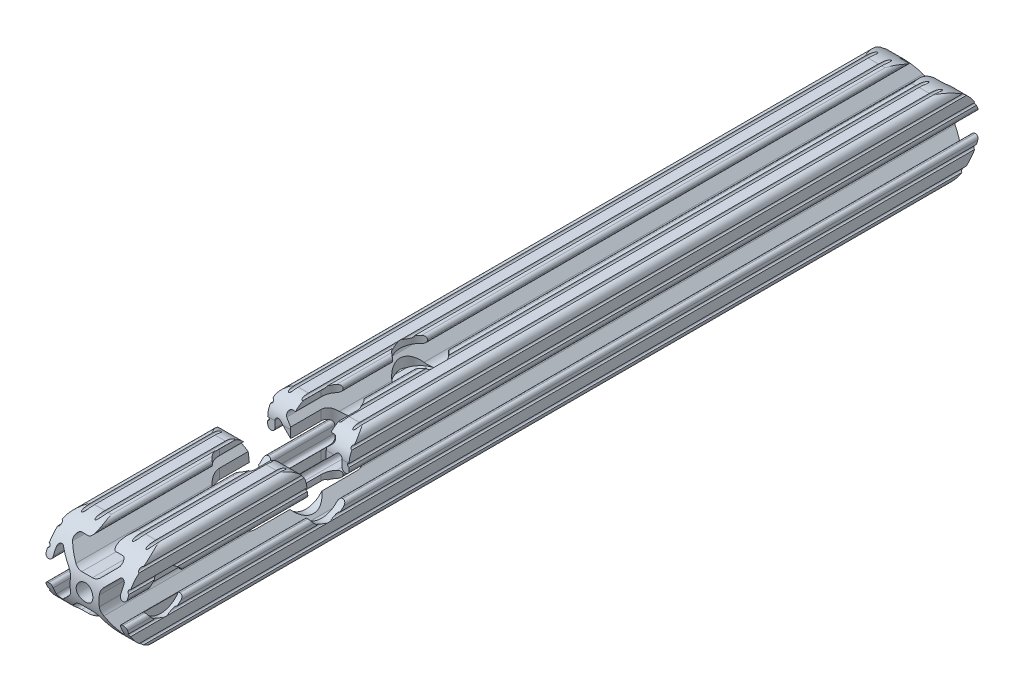
from build123d import *
from OCP.BRepAlgoAPI import BRepAlgoAPI_Cut
from OCP.TopTools import TopTools_ListOfShape

# Parameters (mm, degrees)
SKETCH1_R               = 2.6035
BOSS_EXTRUDE1_DEPTH     = 133.35
CUT_EXTRUDE1_DEPTH      = 136.054229746
CUT_EXTRUDE1_DEPTH_BACK = 136.054229746
SKETCH2_R               = 3.175
SKETCH3_R               = 6.35
CUT_EXTRUDE2_DEPTH      = 1.5875
CUT_EXTRUDE3_START      = -23.8125
SKETCH3_2_R             = 6.35
CUT_EXTRUDE3_DEPTH      = 1.5875
CUT_EXTRUDE10_START     = -26
CUT_EXTRUDE10_DEPTH     = 27
SKETCH8_R               = 3.175
CUT_EXTRUDE8_DEPTH      = 137.340282141
CUT_EXTRUDE11_DEPTH     = 137.340282141
CUT_EXTRUDE12_REACH     = 138.34
SKETCH11_R              = 6.35


with BuildPart() as part:
    # Sketch1 → Boss-Extrude1 (new, symmetric)
    with BuildSketch(Plane.XY):
        with BuildLine():
            Line((-7.179650497, -8.645192506), (-3.952270251, -5.423690499))
            ThreePointArc((-3.952270251, -5.423690499), (-2.922936451, -4.736929036), (-1.709253557, -4.4958))
            Line((-1.709253557, -4.4958), (1.709253557, -4.4958))
            ThreePointArc((1.709253557, -4.4958), (2.922936451, -4.736929036), (3.952270251, -5.423690499))
            Line((3.952270251, -5.423690499), (7.179650497, -8.645192506))
            ThreePointArc((7.179650497, -8.645192506), (7.41473083, -9.822813117), (6.416408329, -10.4902))
            Line((6.416408329, -10.4902), (4.287512407, -10.4902))
            ThreePointArc((4.287512407, -10.4902), (3.54574862, -10.79744862), (3.2385, -11.539212407))
            Line((3.2385, -11.539212407), (3.2385, -11.650987593))
            ThreePointArc((3.2385, -11.650987593), (3.54574862, -12.39275138), (4.287512407, -12.7))
            Line((4.287512407, -12.7), (5.317126718, -12.7))
            ThreePointArc((5.317126718, -12.7), (5.825126718, -12.192), (6.333126718, -12.7))
            Line((6.333126718, -12.7), (9.550443118, -12.7))
            ThreePointArc((9.550443118, -12.7), (10.058366869, -12.192000006), (10.566443095, -12.699847501))
            ThreePointArc((10.566443095, -12.699847501), (12.082537762, -12.08250727), (12.699846982, -10.566399977))
            ThreePointArc((12.699846982, -10.566399977), (12.192000006, -10.058323491), (12.7, -9.5504))
            Line((12.7, -9.5504), (12.7, -6.3330836))
            ThreePointArc((12.7, -6.3330836), (12.192, -5.8250836), (12.7, -5.3170836))
            Line((12.7, -5.3170836), (12.7, -4.287469289))
            ThreePointArc((12.7, -4.287469289), (12.39275138, -3.545705502), (11.650987593, -3.238456882))
            Line((11.650987593, -3.238456882), (11.539212407, -3.238456882))
            ThreePointArc((11.539212407, -3.238456882), (10.79744862, -3.545705502), (10.4902, -4.287469289))
            Line((10.4902, -4.287469289), (10.4902, -6.402089023))
            ThreePointArc((10.4902, -6.402089023), (9.856505071, -7.351067942), (8.737131347, -7.129408934))
            Line((8.737131347, -7.129408934), (5.441005833, -3.840816462))
            ThreePointArc((5.441005833, -3.840816462), (4.750877967, -2.809883091), (4.5085, -1.593185507))
            Line((4.5085, -1.593185507), (4.5085, 1.593185507))
            ThreePointArc((4.5085, 1.593185507), (4.750877967, 2.809883091), (5.441005833, 3.840816462))
            Line((5.441005833, 3.840816462), (8.737131347, 7.129408934))
            ThreePointArc((8.737131347, 7.129408934), (9.856505071, 7.351067942), (10.4902, 6.402089023))
            Line((10.4902, 6.402089023), (10.4902, 4.287469289))
            ThreePointArc((10.4902, 4.287469289), (10.79744862, 3.545705502), (11.539212407, 3.238456882))
            Line((11.539212407, 3.238456882), (11.650987593, 3.238456882))
            ThreePointArc((11.650987593, 3.238456882), (12.39275138, 3.545705502), (12.7, 4.287469289))
            Line((12.7, 4.287469289), (12.7, 5.3170836))
            ThreePointArc((12.7, 5.3170836), (12.192, 5.8250836), (12.7, 6.3330836))
            Line((12.7, 6.3330836), (12.7, 9.5504))
            ThreePointArc((12.7, 9.5504), (12.192000006, 10.058323491), (12.699846982, 10.566399977))
            ThreePointArc((12.699846982, 10.566399977), (12.082537762, 12.08250727), (10.566443095, 12.699847501))
            ThreePointArc((10.566443095, 12.699847501), (10.058366869, 12.192000006), (9.550443118, 12.7))
            Line((9.550443118, 12.7), (6.333126718, 12.7))
            ThreePointArc((6.333126718, 12.7), (5.825126718, 12.192), (5.317126718, 12.7))
            Line((5.317126718, 12.7), (4.287512407, 12.7))
            ThreePointArc((4.287512407, 12.7), (3.54574862, 12.39275138), (3.2385, 11.650987593))
            Line((3.2385, 11.650987593), (3.2385, 11.539212407))
            ThreePointArc((3.2385, 11.539212407), (3.54574862, 10.79744862), (4.287512407, 10.4902))
            Line((4.287512407, 10.4902), (6.476788598, 10.4902))
            ThreePointArc((6.476788598, 10.4902), (7.432222385, 9.85140422), (7.207036008, 8.724370562))
            Line((7.207036008, 8.724370562), (3.898272566, 5.423169045))
            ThreePointArc((3.898272566, 5.423169045), (2.869120213, 4.736787962), (1.655778399, 4.4958))
            Line((1.655778399, 4.4958), (-1.655778399, 4.4958))
            ThreePointArc((-1.655778399, 4.4958), (-2.869120213, 4.736787962), (-3.898272566, 5.423169045))
            Line((-3.898272566, 5.423169045), (-7.207036008, 8.724370562))
            ThreePointArc((-7.207036008, 8.724370562), (-7.432222385, 9.85140422), (-6.476788598, 10.4902))
            Line((-6.476788598, 10.4902), (-4.287512407, 10.4902))
            ThreePointArc((-4.287512407, 10.4902), (-3.54574862, 10.79744862), (-3.2385, 11.539212407))
            Line((-3.2385, 11.539212407), (-3.2385, 11.650987593))
            ThreePointArc((-3.2385, 11.650987593), (-3.54574862, 12.39275138), (-4.287512407, 12.7))
            Line((-4.287512407, 12.7), (-5.317126718, 12.7))
            ThreePointArc((-5.317126718, 12.7), (-5.825126718, 12.192), (-6.333126718, 12.7))
            Line((-6.333126718, 12.7), (-9.550443118, 12.7))
            ThreePointArc((-9.550443118, 12.7), (-10.058366869, 12.192000006), (-10.566443095, 12.699847501))
            ThreePointArc((-10.566443095, 12.699847501), (-12.082537762, 12.08250727), (-12.699846982, 10.566399977))
            ThreePointArc((-12.699846982, 10.566399977), (-12.192000006, 10.058323491), (-12.7, 9.5504))
            Line((-12.7, 9.5504), (-12.7, 6.3330836))
            ThreePointArc((-12.7, 6.3330836), (-12.192, 5.8250836), (-12.7, 5.3170836))
            Line((-12.7, 5.3170836), (-12.7, 4.287469289))
            ThreePointArc((-12.7, 4.287469289), (-12.39275138, 3.545705502), (-11.650987593, 3.238456882))
            Line((-11.650987593, 3.238456882), (-11.539212407, 3.238456882))
            ThreePointArc((-11.539212407, 3.238456882), (-10.79744862, 3.545705502), (-10.4902, 4.287469289))
            Line((-10.4902, 4.287469289), (-10.4902, 6.402089023))
            ThreePointArc((-10.4902, 6.402089023), (-9.856505071, 7.351067942), (-8.737131347, 7.129408934))
            Line((-8.737131347, 7.129408934), (-5.441005833, 3.840816462))
            ThreePointArc((-5.441005833, 3.840816462), (-4.750877967, 2.809883091), (-4.5085, 1.593185507))
            Line((-4.5085, 1.593185507), (-4.5085, -1.593185507))
            ThreePointArc((-4.5085, -1.593185507), (-4.750877967, -2.809883091), (-5.441005833, -3.840816462))
            Line((-5.441005833, -3.840816462), (-8.737131347, -7.129408934))
            ThreePointArc((-8.737131347, -7.129408934), (-9.856505071, -7.351067942), (-10.4902, -6.402089023))
            Line((-10.4902, -6.402089023), (-10.4902, -4.287469289))
            ThreePointArc((-10.4902, -4.287469289), (-10.79744862, -3.545705502), (-11.539212407, -3.238456882))
            Line((-11.539212407, -3.238456882), (-11.650987593, -3.238456882))
            ThreePointArc((-11.650987593, -3.238456882), (-12.39275138, -3.545705502), (-12.7, -4.287469289))
            Line((-12.7, -4.287469289), (-12.7, -5.3170836))
            ThreePointArc((-12.7, -5.3170836), (-12.192, -5.8250836), (-12.7, -6.3330836))
            Line((-12.7, -6.3330836), (-12.7, -9.5504))
            ThreePointArc((-12.7, -9.5504), (-12.192000006, -10.058323491), (-12.699846982, -10.566399977))
            ThreePointArc((-12.699846982, -10.566399977), (-12.082537762, -12.08250727), (-10.566443095, -12.699847501))
            ThreePointArc((-10.566443095, -12.699847501), (-10.058366869, -12.192000006), (-9.550443118, -12.7))
            Line((-9.550443118, -12.7), (-6.333126718, -12.7))
            ThreePointArc((-6.333126718, -12.7), (-5.825126718, -12.192), (-5.317126718, -12.7))
            Line((-5.317126718, -12.7), (-4.287512407, -12.7))
            ThreePointArc((-4.287512407, -12.7), (-3.54574862, -12.39275138), (-3.2385, -11.650987593))
            Line((-3.2385, -11.650987593), (-3.2385, -11.539212407))
            ThreePointArc((-3.2385, -11.539212407), (-3.54574862, -10.79744862), (-4.287512407, -10.4902))
            Line((-4.287512407, -10.4902), (-6.416408329, -10.4902))
            ThreePointArc((-6.416408329, -10.4902), (-7.41473083, -9.822813117), (-7.179650497, -8.645192506))
        make_face()
        Circle(SKETCH1_R, mode=Mode.SUBTRACT)
    extrude(amount=BOSS_EXTRUDE1_DEPTH, both=True)

    # Sketch2 → Cut-Extrude1 (cut, two sides: drawn at the far end of the back side and taken through both)
    with BuildSketch(Plane(origin=(4.5085, 0, 0), x_dir=(0, 0, -1), z_dir=(1, 0, 0)).offset(-CUT_EXTRUDE1_DEPTH_BACK)):
        with Locations(Location((-120.65, 0, 0), (0, 0, 149.88145664))):
            Circle(SKETCH2_R)
    extrude(amount=CUT_EXTRUDE1_DEPTH + CUT_EXTRUDE1_DEPTH_BACK, mode=Mode.SUBTRACT)

    # Sketch3 → Cut-Extrude2 (cut)
    with BuildSketch(Plane(origin=(12.7, 0, 0), x_dir=(0, 0, -1), z_dir=(1, 0, 0))):
        with Locations((-120.65, 0)):
            Circle(SKETCH3_R)
    extrude(amount=-CUT_EXTRUDE2_DEPTH, mode=Mode.SUBTRACT)

    # Sketch3<2> → Cut-Extrude3 (cut)
    with BuildSketch(Plane(origin=(12.7, 0, 0), x_dir=(0, 0, -1), z_dir=(1, 0, 0)).offset(CUT_EXTRUDE3_START)):
        with Locations((-120.65, 0)):
            Circle(SKETCH3_2_R)
    extrude(amount=-CUT_EXTRUDE3_DEPTH, mode=Mode.SUBTRACT)


with BuildPart() as cut_extrude10_tool:
    # Cut-Extrude10: read off the stored shape, not the designer's step
    # Cut-Extrude10 outline → Cut-Extrude10 (new body)
    with BuildSketch(Plane(origin=(12.7, 0, 0), x_dir=(0, 0, -1), z_dir=(1, 0, 0)).offset(CUT_EXTRUDE10_START)):
        with BuildLine():
            ThreePointArc((-76.2, 7.6249e-05), (-69.85, -6.349923751), (-63.5, 7.6249e-05))
            Line((-63.5, 7.6249e-05), (-63.5, 6.35))
            ThreePointArc((-63.5, 6.35), (-61.640128061, 10.840128061), (-57.15, 12.7))
            Line((-57.15, 12.7), (-83.082893377, 12.7))
            ThreePointArc((-83.082893377, 12.7), (-78.983986003, 11.19989261), (-76.82170894, 7.408333333))
            ThreePointArc((-76.82170894, 7.408333333), (-76.355703117, 3.71722526), (-76.2, 7.6249e-05))
        make_face()
    extrude(amount=CUT_EXTRUDE10_DEPTH)


with BuildPart() as part_1:
    add(part.part)

    # Cut-Extrude10: cut by cut_extrude10_tool, with a tolerance
    cut_extrude10_stock = TopTools_ListOfShape()
    cut_extrude10_stock.Append(part_1.part.wrapped)
    cut_extrude10_tools = TopTools_ListOfShape()
    cut_extrude10_tools.Append(cut_extrude10_tool.part.wrapped)
    cut_extrude10_cut = BRepAlgoAPI_Cut()
    cut_extrude10_cut.SetArguments(cut_extrude10_stock)
    cut_extrude10_cut.SetTools(cut_extrude10_tools)
    cut_extrude10_cut.SetFuzzyValue(0.00001)
    cut_extrude10_cut.Build()
    add(Compound.cast(cut_extrude10_cut.Shape()).solids(), mode=Mode.REPLACE)

    # Sketch8 → Cut-Extrude8 (cut, through all)
    with BuildSketch(Plane.XZ.offset(12.7)):
        with BuildLine():
            Line((5.556173491, 85.725), (5.556173491, 53.975))
            ThreePointArc((5.556173491, 53.975), (-7.6509e-05, 48.41875), (-5.556326509, 53.975))
            Line((-5.556326509, 53.975), (-5.556326509, 85.725))
            ThreePointArc((-5.556326509, 85.725), (-7.6509e-05, 91.28125), (5.556173491, 85.725))
        make_face()
        with Locations(Location((-7.6509e-05, 28.575, 0), (0, 0, 238.568359455))):
            Circle(SKETCH8_R)
    extrude(amount=-CUT_EXTRUDE8_DEPTH, mode=Mode.SUBTRACT)

    # Sketch10 → Cut-Extrude11 (cut, through all)
    with BuildSketch(Plane(origin=(12.7, 0, 0), x_dir=(0, 0, -1), z_dir=(1, 0, 0))):
        with BuildLine():
            ThreePointArc((-120.65, -12.7), (-129.630256121, -8.980256121), (-133.35, 0))
            Line((-133.35, 0), (-133.35, -12.7))
            Line((-133.35, -12.7), (-120.65, -12.7))
        make_face()
        with BuildLine():
            Line((133.35, 12.7), (120.65, 12.7))
            ThreePointArc((120.65, 12.7), (129.630256121, 8.980256121), (133.35, 0))
            Line((133.35, 0), (133.35, 12.7))
        make_face()
        with BuildLine():
            Line((133.35, -12.7), (133.35, 0))
            ThreePointArc((133.35, 0), (129.630256121, -8.980256121), (120.65, -12.7))
            Line((120.65, -12.7), (133.35, -12.7))
        make_face()
        with BuildLine():
            Line((-131.658271986, 6.3330836), (-133.35, 6.3330836))
            Line((-133.35, 6.3330836), (-133.35, 0))
            ThreePointArc((-133.35, 0), (-132.919781054, 3.277571188), (-131.658271986, 6.3330836))
        make_face()
        with BuildLine():
            Line((-129.021371443, 9.5504), (-133.35, 9.5504))
            Line((-133.35, 9.5504), (-133.35, 6.3330836))
            Line((-133.35, 6.3330836), (-131.658271986, 6.3330836))
            ThreePointArc((-131.658271986, 6.3330836), (-130.472445015, 8.050439363), (-129.021371443, 9.5504))
        make_face()
        with BuildLine():
            Line((-120.65, 12.7), (-133.35, 12.7))
            Line((-133.35, 12.7), (-133.35, 9.5504))
            Line((-133.35, 9.5504), (-129.021371443, 9.5504))
            ThreePointArc((-129.021371443, 9.5504), (-125.122131483, 11.8865487), (-120.65, 12.7))
        make_face()
    extrude(amount=-CUT_EXTRUDE11_DEPTH, mode=Mode.SUBTRACT)

    # Cut-Extrude12: up to this face of the body (flat: up to its plane)
    cut_extrude12_end = Plane(part_1.part.faces().sort_by_distance((1.53e-07, 4.4958, -53.488525303))[0])
    # Sketch11 → Cut-Extrude12 (cut, up to the picked face)
    with BuildSketch(Plane(origin=(0, 12.7, 0), x_dir=(1, 0, 0), z_dir=(0, 1, 0)), mode=Mode.PRIVATE) as cut_extrude12_sk1:
        with Locations((-7.6509e-05, -28.575)):
            Circle(SKETCH11_R)
    cut_extrude12_tool1 = split(extrude(cut_extrude12_sk1.sketch, amount=-CUT_EXTRUDE12_REACH, mode=Mode.PRIVATE), bisect_by=cut_extrude12_end, keep=Keep.BOTH, mode=Mode.PRIVATE)
    add(cut_extrude12_tool1.solids().sort_by(Axis((-7.7e-05, 12.7, 28.575), (0, -1, 0)))[0], mode=Mode.SUBTRACT)


solid = part_1.part
